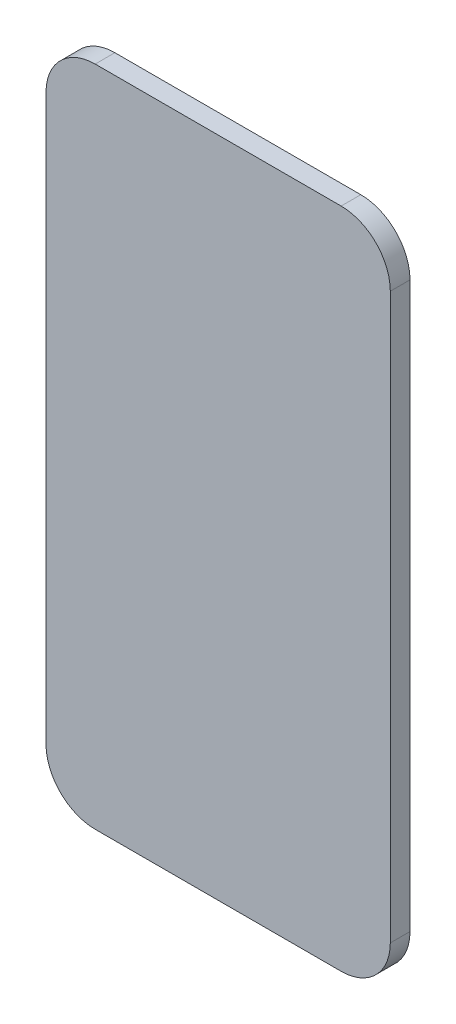
from build123d import *

# Parameters (mm, degrees)
SKETCH1_W           = 700
SKETCH1_H           = 1347.409326425
BOSS_EXTRUDE1_DEPTH = 40
FILLET1_R           = 100


with BuildPart() as part:
    # Sketch1 → Boss-Extrude1 (new body)
    with BuildSketch(Plane.XY):
        with Locations((350, 673.704663213)):
            Rectangle(SKETCH1_W, SKETCH1_H)
    extrude(amount=BOSS_EXTRUDE1_DEPTH)

    # Fillet1
    fillet1_edges = [part.edges().sort_by_distance(p)[0] for p in [
        (700, 0, 20),
        (0, 0, 20),
        (0, 1347.409326425, 20),
        (700, 1347.409326425, 20),
    ]]
    fillet(fillet1_edges, radius=FILLET1_R)


solid = part.part
